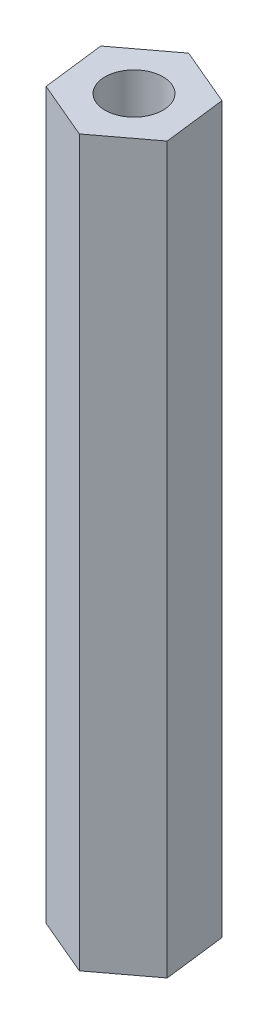
from build123d import *

# Parameters (mm, degrees)
SKETCH_1_R      = 1.6
EXTRUDE_1_DEPTH = 40


with BuildPart() as part:
    # 草图1 → 凸台-拉伸1 (new body)
    with BuildSketch(Plane(origin=(0, 0, 0), x_dir=(1, 0, 0), z_dir=(0, 1, 0))):
        Polygon((2.767176381, 2.083922954), (-0.421142027, 3.438406519), (-3.188318408, 1.354483566), (-2.767176381, -2.083922954), (0.421142027, -3.438406519), (3.188318408, -1.354483566), align=None)
        Circle(SKETCH_1_R, mode=Mode.SUBTRACT)
    extrude(amount=EXTRUDE_1_DEPTH)


solid = part.part
